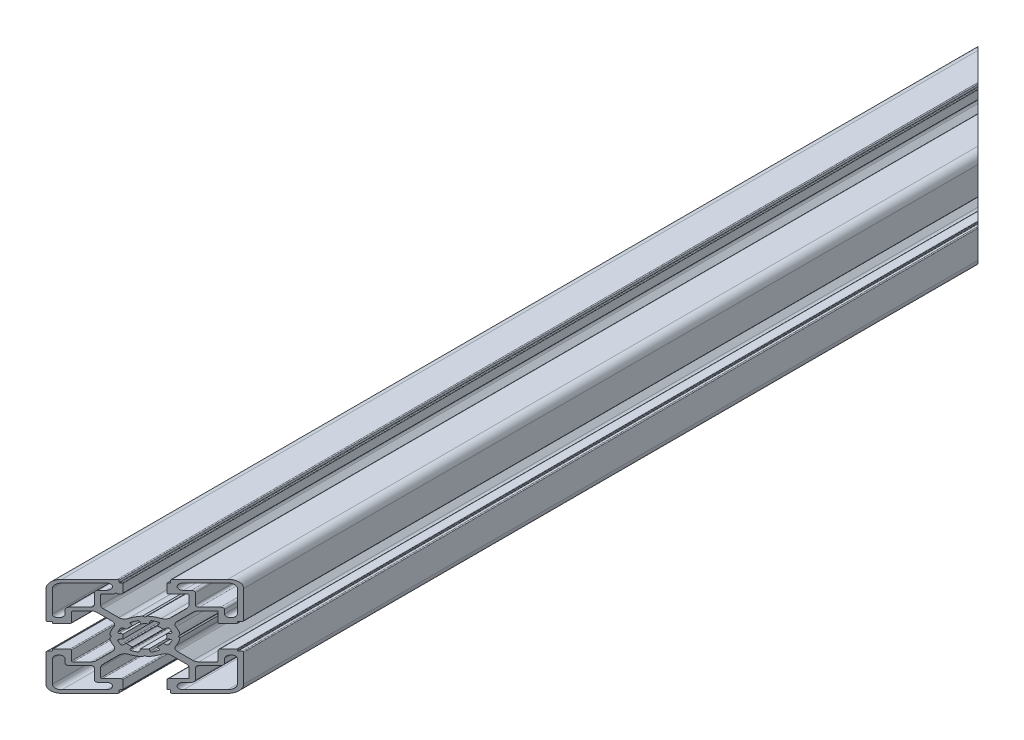
from build123d import *

# Parameters (mm, degrees)
BOSS_EXTRUDE1_DEPTH      = 1524
FILLET4_R                = 1.885
FILLET5_R                = 0.377
DELETEFACE1_START        = -1524
DELETEFACE1_DEPTH        = 3048
CUT_EXTRUDE1_START       = -1524
CUT_EXTRUDE1_DEPTH       = 3048
CIRPATTERN2_COUNT        = 3
CIRPATTERN2_ANGLE        = 180
FILLET2_R                = 0.377
FILLET3_R                = 0.1885
CUT_EXTRUDE2_START       = -3048
SKETCH5_R                = 6.375
CUT_EXTRUDE2_DEPTH       = 3048
BOSS_EXTRUDE2_DEPTH      = 1524
FILLET6_R                = 0.377
CIRPATTERN1_COUNT        = 8
FILLET6_OF_CIRPATTERN1_R = 0.377
CUT_EXTRUDE3_START       = -1524
CUT_EXTRUDE3_DEPTH       = 3048
SKETCH8_W                = 50.320163656
SKETCH8_H                = 51.920155658
CUT_EXTRUDE4_DEPTH       = 2623.735931288
CUT_EXTRUDE5_DEPTH       = 2623.735931288
CUT_EXTRUDE6_DEPTH       = 2623.735931288


# Read off the part's stored shape, not the designer's step: DeleteFace1
with BuildPart() as part:
    # Sketch3 → Boss-Extrude1 (new, symmetric)
    with BuildSketch(Plane.XY):
        with BuildLine():
            Line((0, -8), (0, -5))
            ThreePointArc((0, -5), (3.535533906, -3.535533906), (5, 0))
            Line((5, 0), (8, 0))
            ThreePointArc((8, 0), (7.57237156, -2.58054044), (6.335202759, -4.885202759))
            Line((6.335202759, -4.885202759), (11.5, -10.05))
            Line((11.5, -10.05), (16.7, -10.05))
            Line((16.7, -10.05), (16.7, -5))
            Line((16.7, -5), (21.05, -5))
            Line((21.05, -5), (21.05, 0))
            Line((21.05, 0), (22.5, 0))
            Line((22.5, 0), (22.5, -18.875))
            ThreePointArc((22.5, -18.875), (21.438262082, -21.438262082), (18.875, -22.5))
            Line((18.875, -22.5), (0, -22.5))
            Line((0, -22.5), (0, -21.05))
            Line((0, -21.05), (5, -21.05))
            Line((5, -21.05), (5, -16.7))
            Line((5, -16.7), (10.05, -16.7))
            Line((10.05, -16.7), (10.05, -11.5))
            Line((10.05, -11.5), (4.885202759, -6.335202759))
            ThreePointArc((4.885202759, -6.335202759), (2.58054044, -7.57237156), (0, -8))
        make_face()
        with BuildLine():
            Line((18.15, -8.79375), (18.15, -10.5575))
            ThreePointArc((18.15, -10.5575), (17.873948141, -11.223948141), (17.2075, -11.5))
            Line((17.2075, -11.5), (12.4425, -11.5))
            ThreePointArc((12.4425, -11.5), (11.776051859, -11.776051859), (11.5, -12.4425))
            Line((11.5, -12.4425), (11.5, -17.2075))
            ThreePointArc((11.5, -17.2075), (11.223948141, -17.873948141), (10.5575, -18.15))
            Line((10.5575, -18.15), (8.79375, -18.15))
            ThreePointArc((8.79375, -18.15), (7.34375, -19.6), (8.79375, -21.05))
            Line((8.79375, -21.05), (18.875, -21.05))
            ThreePointArc((18.875, -21.05), (20.412957249, -20.412957249), (21.05, -18.875))
            Line((21.05, -18.875), (21.05, -8.79375))
            ThreePointArc((21.05, -8.79375), (19.6, -7.34375), (18.15, -8.79375))
        make_face(mode=Mode.SUBTRACT)
    extrude(amount=BOSS_EXTRUDE1_DEPTH, both=True)

    # Fillet4
    fillet4_edges = [part.edges().sort_by_distance(p)[0] for p in [
        (10.05, -11.5, 0),
        (4.885202759, -6.335202759, 0),
        (6.335202759, -4.885202759, 0),
        (11.5, -10.05, 0),
    ]]
    fillet(fillet4_edges, radius=FILLET4_R)

    # Fillet5
    fillet5_edges = [part.edges().sort_by_distance(p)[0] for p in [
        (5, -21.05, 0),
        (5, -16.7, 0),
        (10.05, -16.7, 0),
        (16.7, -10.05, 0),
        (16.7, -5, 0),
        (21.05, -5, 0),
    ]]
    fillet(fillet5_edges, radius=FILLET5_R)

    # Mirror1: part across plane


with BuildPart() as part_1:
    add(part.part)
    add(part.part.mirror(Plane.ZX))

    # DeleteFace1 outline → DeleteFace1 (cut)
    with BuildSketch(Plane.XY.offset(DELETEFACE1_START)):
        with BuildLine():
            ThreePointArc((4.623, 21.05), (4.889579257, 20.939579257), (5, 20.673))
            Line((5, 20.673), (5, 21.05))
            Line((5, 21.05), (4.623, 21.05))
        make_face()
    extrude(amount=DELETEFACE1_DEPTH, mode=Mode.SUBTRACT)

    # Sketch4 → Cut-Extrude1 (cut)
    with BuildSketch(Plane.XY.offset(CUT_EXTRUDE1_START)):
        Polygon((5.85, 21.05), (5.85, 22.5), (0, 22.5), (-5.85, 22.5), (-5.85, 21.05), (-5, 21.05), (-5, 16.7), (5, 16.7), (5, 21.05), align=None)
    cut_extrude1 = extrude(amount=CUT_EXTRUDE1_DEPTH, mode=Mode.SUBTRACT)

    # CirPattern2: Cut-Extrude1 ×3 about axis
    cirpattern2_axis = Axis((0, 0, 1489), (0, 0, -1))
    for i in range(1, CIRPATTERN2_COUNT):
        add(cut_extrude1.rotate(cirpattern2_axis, i * CIRPATTERN2_ANGLE / (CIRPATTERN2_COUNT - 1)), mode=Mode.SUBTRACT)

    # Fillet2
    fillet2_edges = [part_1.edges().sort_by_distance(p)[0] for p in [
        (5.85, 22.5, 0),
        (22.5, 5.85, 0),
        (22.5, -5.85, 0),
        (5.85, -22.5, 0),
    ]]
    fillet(fillet2_edges, radius=FILLET2_R)

    # Fillet3
    fillet3_edges = [part_1.edges().sort_by_distance(p)[0] for p in [
        (5, 21.05, 0),
        (5.85, 21.05, 0),
        (21.05, -5, 0),
        (21.05, -5.85, 0),
        (21.05, 5, 0),
        (21.05, 5.85, 0),
        (5, -21.05, 0),
        (5.85, -21.05, 0),
    ]]
    fillet(fillet3_edges, radius=FILLET3_R)

    # Mirror2: part across plane


with BuildPart() as part_2:
    add(part_1.part)
    add(part_1.part.mirror(Plane(origin=(0, 0, 0), x_dir=(0, 0, 1), z_dir=(1, 0, 0))))

    # Sketch5 → Cut-Extrude2 (cut)
    with BuildSketch(Plane.XY.offset(1524).offset(CUT_EXTRUDE2_START)):
        Circle(SKETCH5_R)
        Polygon((-0.580185128, 8), (0.580185128, 8), (0, 7.59375), align=None)
        Polygon((-8, 0.580185128), (-8, -0.580185128), (-7.59375, 0), align=None)
        Polygon((8, 0.580185128), (8, -0.580185128), (7.59375, 0), align=None)
        Polygon((-0.580185128, -8), (0.580185128, -8), (0, -7.59375), align=None)
    extrude(amount=CUT_EXTRUDE2_DEPTH, mode=Mode.SUBTRACT)

    # Sketch6 → Boss-Extrude2 (add, symmetric)
    with BuildSketch(Plane.XY):
        with BuildLine():
            Line((-0.97545161, -4.903926402), (-1.243700803, -6.252506163))
            ThreePointArc((-1.243700803, -6.252506163), (0, -6.375), (1.243700803, -6.252506163))
            Line((1.243700803, -6.252506163), (0.97545161, -4.903926402))
            ThreePointArc((0.97545161, -4.903926402), (0, -5), (-0.97545161, -4.903926402))
        make_face()
    boss_extrude2 = extrude(amount=BOSS_EXTRUDE2_DEPTH, both=True)

    # Fillet6
    fillet6_edges = [part_2.edges().sort_by_distance(p)[0] for p in [
        (-1.243700803, -6.252506163, 0),
        (1.243700803, -6.252506163, 0),
    ]]
    fillet(fillet6_edges, radius=FILLET6_R)

    # CirPattern1: Boss-Extrude2 ×8 about axis
    cirpattern1_axis = Axis((0, 0, 0), (0, 0, 1))
    for i in range(1, CIRPATTERN1_COUNT):
        add(boss_extrude2.rotate(cirpattern1_axis, i * 360 / CIRPATTERN1_COUNT))

    # Fillet6 of CirPattern1
    fillet6_of_cirpattern1_edges = [part_2.edges().sort_by_distance(p)[0] for p in [
        (3.541760235, -5.300618778, 0),
        (5.300618778, -3.541760235, 0),
        (6.252506163, -1.243700803, 0),
        (6.252506163, 1.243700803, 0),
        (5.300618778, 3.541760235, 0),
        (3.541760235, 5.300618778, 0),
        (1.243700803, 6.252506163, 0),
        (-1.243700803, 6.252506163, 0),
        (-3.541760235, 5.300618778, 0),
        (-5.300618778, 3.541760235, 0),
        (-6.252506163, 1.243700803, 0),
        (-6.252506163, -1.243700803, 0),
        (-5.300618778, -3.541760235, 0),
        (-3.541760235, -5.300618778, 0),
    ]]
    fillet(fillet6_of_cirpattern1_edges, radius=FILLET6_OF_CIRPATTERN1_R)

    # Sketch7 → Cut-Extrude3 (cut)
    with BuildSketch(Plane.XY.offset(CUT_EXTRUDE3_START)):
        Polygon((-7.031875, 16.7), (-6.596875, 17.135), (-6.161875, 16.7), align=None)
    extrude(amount=CUT_EXTRUDE3_DEPTH, mode=Mode.SUBTRACT)

    # Sketch8 → Cut-Extrude4 (cut)
    with BuildSketch(Plane.XY.offset(1524)):
        Rectangle(SKETCH8_W, SKETCH8_H)
    extrude(amount=-CUT_EXTRUDE4_DEPTH, mode=Mode.SUBTRACT)

    # Sketch9 → Cut-Extrude5 (cut)
    with BuildSketch(Plane(origin=(0, 22.5, 0), x_dir=(1, 0, 0), z_dir=(0, 1, 0))):
        Polygon((-22.5, 1099.735931288), (22.5, 1144.735931288), (22.5, 1099.735931288), align=None)
    extrude(amount=-CUT_EXTRUDE5_DEPTH, mode=Mode.SUBTRACT)

    # Sketch10 → Cut-Extrude6 (cut)
    with BuildSketch(Plane(origin=(0, 22.5, 0), x_dir=(1, 0, 0), z_dir=(0, 1, 0))):
        Polygon((-22.5, 1524), (22.5, 1479), (22.5, 1524), align=None)
    extrude(amount=-CUT_EXTRUDE6_DEPTH, mode=Mode.SUBTRACT)


solid = part_2.part
